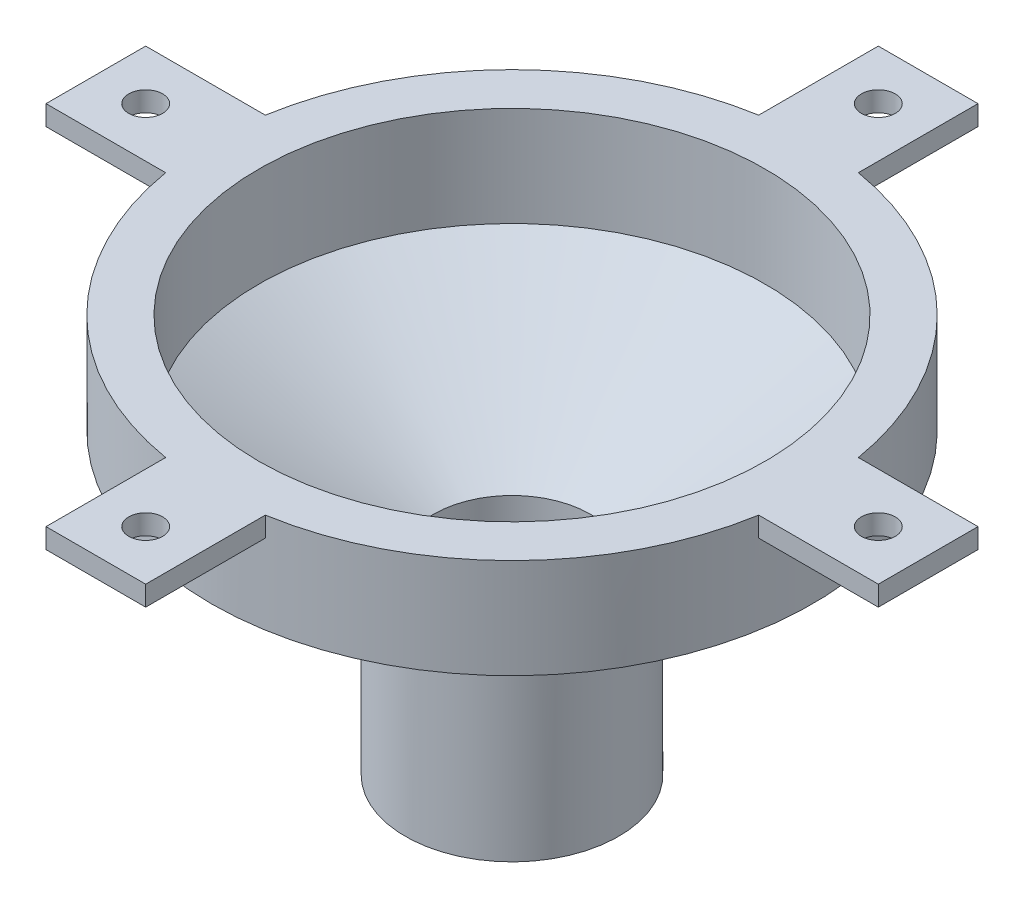
from build123d import *
from build123d.topology import SkipClean

# Parameters (mm, degrees)
SKETCH5_OUTSIDE_W   = 34.468
SKETCH5_OUTSIDE_H   = 34.468
CUT_EXTRUDE1_DEPTH  = 7.2
BOSS_EXTRUDE1_REACH = 51.718
SKETCH10_R          = 10.705
SKETCH10_R_2        = 6.9
SKETCH22_R          = 10.705
SKETCH22_R_2        = 7.874
BOSS_EXTRUDE7_DEPTH = 3
BOSS_EXTRUDE3_REACH = 31.655
SKETCH12_R          = 8.3
CUT_EXTRUDE3_REACH  = 56.551
SKETCH13_R          = 3.45
SKETCH14_R          = 23.979548074
CUT_EXTRUDE5_DEPTH  = 32
SKETCH17_R          = 30.1625
SKETCH17_R_2        = 25.4
BOSS_EXTRUDE5_DEPTH = 10
BOSS_EXTRUDE6_START = -2
SKETCH18_R          = 1.7
BOSS_EXTRUDE6_DEPTH = 2


# Read off the part's stored shape, not the designer's step: Cut-Extrude2
with BuildPart() as part:
    # Sketch1 → Revolve1 (revolve)
    with BuildSketch(Plane.XY, mode=Mode.PRIVATE) as revolve1_sk:
        Polygon((3.25, 47.7), (4.8, 47.7), (5.2, 43.217813034), (4.8, 42.533333333), (5.2, 38.051146367), (4.8, 37.366666667), (5.2, 32.8844797), (4.8, 32.2), (5.25, 26.2), (5.25, 22.2), (10.6, 22.2), (10.6, 15), (8.3, 15), (8.3, 0), (5.5, 0), (5.5, 18), (3.25, 19.7), align=None)
    revolve(revolve1_sk.sketch.rotate(Axis((0, 0, 0), (0, 1, 0)), 90), axis=Axis((0, 0, 0), (0, 1, 0)))

    # Sketch5 outside → Cut-Extrude1 (cut)
    with BuildSketch(Plane(origin=(0, 22.2, 0), x_dir=(1, 0, 0), z_dir=(0, 1, 0))):
        Rectangle(SKETCH5_OUTSIDE_W, SKETCH5_OUTSIDE_H)
        Polygon((-5.3, 9.17986928), (5.3, 9.17986928), (10.6, 0), (5.3, -9.17986928), (-5.3, -9.17986928), (-10.6, 0), align=None, mode=Mode.SUBTRACT)
    extrude(amount=-CUT_EXTRUDE1_DEPTH, mode=Mode.SUBTRACT)

    # Sketch4 → Cut-Revolve1 (revolve, cut)
    with BuildSketch(Plane.XY, mode=Mode.PRIVATE) as cut_revolve1_sk:
        Polygon((6.9, 0), (8.3, 1.4), (8.3, 0), align=None)
        Polygon((8.3, 15), (10.6, 15.837131539), (10.6, 15), align=None)
        Polygon((8.3, 22.2), (10.6, 21.362868461), (10.6, 22.2), align=None)
    revolve(cut_revolve1_sk.sketch.rotate(Axis((0, 0, 0), (0, 1, 0)), 90), axis=Axis((0, 0, 0), (0, 1, 0)), mode=Mode.SUBTRACT)

    # Boss-Extrude1: up to this cone (the profile starts outside it)
    boss_extrude1_end = Plane(origin=(0, 0, 0), z_dir=(0, 1, 0)).offset(11.979048056) * Cone(2.747e-06, 110.555614597, 40.238951944, align=(Align.CENTER, Align.CENTER, Align.MIN), mode=Mode.PRIVATE)
    # Sketch10 → Boss-Extrude1 (add, up to the surface)
    with BuildSketch(Plane.XZ, mode=Mode.PRIVATE) as boss_extrude1_sk1:
        with Locations(Location((0, 0, 0), (0, 0, 270))):
            Circle(SKETCH10_R)
        Circle(SKETCH10_R_2, mode=Mode.SUBTRACT)
    boss_extrude1_tool1 = extrude(boss_extrude1_sk1.sketch, amount=-BOSS_EXTRUDE1_REACH, mode=Mode.PRIVATE) - boss_extrude1_end
    add(boss_extrude1_tool1.solids().sort_by_distance((0, 0, 10.402217))[0])

    # Cut-Extrude2 outline → Cut-Extrude2 (revolve, cut)
    with BuildSketch(Plane.XY):
        Polygon((7.874, 16.206311111), (5.5, 18), (5.5, 0), (7.874, 0), align=None)
    revolve(axis=Axis((0, 0, 0), (0, 1, 0)), mode=Mode.SUBTRACT)

    # Sketch22 → Boss-Extrude7 (add)
    with SkipClean():  # the faces are left unmerged after this step: merging them gives an invalid solid
        with BuildSketch(Plane.XZ):
            with Locations(Location((0, 0, 0), (0, 0, 270))):
                Circle(SKETCH22_R)
            with Locations(Location((0, 0, 0), (0, 0, 270))):
                Circle(SKETCH22_R_2, mode=Mode.SUBTRACT)
        extrude(amount=BOSS_EXTRUDE7_DEPTH)

    # Boss-Extrude3: up to this cone (the profile starts inside it)
    with SkipClean():  # the faces are left unmerged after this step: merging them gives an invalid solid
        boss_extrude3_end = Plane(origin=(0, 22.2, 0), z_dir=(0, 1, 0)).offset(-10.220951944) * Cone(2.747e-06, 193.581188051, 70.457789364, align=(Align.CENTER, Align.CENTER, Align.MIN), mode=Mode.PRIVATE)
        # Sketch12 → Boss-Extrude3 (add, up to the surface)
        with BuildSketch(Plane(origin=(0, 22.2, 0), x_dir=(1, 0, 0), z_dir=(0, 1, 0)), mode=Mode.PRIVATE) as boss_extrude3_sk1:
            Polygon((-7.609401077, 13.17986928), (-15.218802154, 0), (-7.609401077, -13.17986928), (7.609401077, -13.17986928), (15.218802154, 0), (7.609401077, 13.17986928), align=None)
            Circle(SKETCH12_R, mode=Mode.SUBTRACT)
        boss_extrude3_tool1 = extrude(boss_extrude3_sk1.sketch, amount=-BOSS_EXTRUDE3_REACH, mode=Mode.PRIVATE) & boss_extrude3_end
        add(boss_extrude3_tool1.solids().sort_by_distance((-11.065395, 22.2, -6.388609))[0])

    # Cut-Extrude3: up to this cone (the profile starts outside it)
    with SkipClean():  # the faces are left unmerged after this step: merging them gives an invalid solid
        cut_extrude3_end = Plane(origin=(0, 47.7, 0), z_dir=(0, -1, 0)).offset(25.544445444) * Cone(1.324e-06, 41.699852941, 31.506554556, align=(Align.CENTER, Align.CENTER, Align.MIN), mode=Mode.PRIVATE)
        # Sketch13 → Cut-Extrude3 (cut, up to the surface)
        with BuildSketch(Plane(origin=(0, 47.7, 0), x_dir=(1, 0, 0), z_dir=(0, 1, 0)), mode=Mode.PRIVATE) as cut_extrude3_sk1:
            with Locations(Location((0, 0, 0), (0, 0, 270))):
                Circle(SKETCH13_R)
        cut_extrude3_tool1 = extrude(cut_extrude3_sk1.sketch, amount=-CUT_EXTRUDE3_REACH, mode=Mode.PRIVATE) - cut_extrude3_end
        add(cut_extrude3_tool1.solids().sort_by_distance((0, 47.7, 0))[0], mode=Mode.SUBTRACT)

    # Sketch14 → Cut-Extrude5 (cut)
    with SkipClean():  # the faces are left unmerged after this step: merging them gives an invalid solid
        with BuildSketch(Plane(origin=(0, 47.7, 0), x_dir=(1, 0, 0), z_dir=(0, 1, 0))):
            Circle(SKETCH14_R)
        extrude(amount=-CUT_EXTRUDE5_DEPTH, mode=Mode.SUBTRACT)

    # Sketch20 → Revolve2 (revolve)
    with SkipClean():  # the faces are left unmerged after this step: merging them gives an invalid solid
        with BuildSketch(Plane(origin=(0, 0, 0), x_dir=(0, 0, -1), z_dir=(1, 0, 0))):
            Polygon((10.705, 15.7), (30.1625, 26.933792863), (27.3315, 26.933792863), (7.874, 15.7), align=None)
        revolve(axis=Axis((0, 30.70199832, 0), (0, -1, 0)))

    # Sketch17 → Boss-Extrude5 (add)
    with SkipClean():  # the faces are left unmerged after this step: merging them gives an invalid solid
        with BuildSketch(Plane(origin=(0, 26.933792863, 0), x_dir=(1, 0, 0), z_dir=(0, 1, 0))):
            with Locations(Location((0, 0, 0), (0, 0, 270))):
                Circle(SKETCH17_R)
            with Locations(Location((0, 0, 0), (0, 0, 270))):
                Circle(SKETCH17_R_2, mode=Mode.SUBTRACT)
        extrude(amount=BOSS_EXTRUDE5_DEPTH)

    # Sketch18 → Boss-Extrude6 (add)
    # profile 1 of 8: a face of its own
    with SkipClean():  # the faces are left unmerged after this step: merging them gives an invalid solid
        with BuildSketch(Plane(origin=(0, 36.933792863, 0), x_dir=(1, 0, 0), z_dir=(0, 1, 0)).offset(BOSS_EXTRUDE6_START)):
            with BuildLine():
                ThreePointArc((-29.745191313, -5), (-30.1625, 0), (-29.745191313, 5))
                Line((-29.745191313, 5), (-41.745191313, 5))
                Line((-41.745191313, 5), (-41.745191313, -5))
                Line((-41.745191313, -5), (-29.745191313, -5))
            make_face()
            with Locations(Location((-36.745191313, 0, 0), (0, 0, 270))):
                Circle(SKETCH18_R, mode=Mode.SUBTRACT)
        # profile 2 of 8: a face of its own
        with BuildSketch(Plane(origin=(0, 36.933792863, 0), x_dir=(1, 0, 0), z_dir=(0, 1, 0)).offset(BOSS_EXTRUDE6_START)):
            with BuildLine():
                Line((-29.745191313, -5), (-29.745191313, 5))
                ThreePointArc((-29.745191313, 5), (-30.1625, 0), (-29.745191313, -5))
            make_face()
        # profile 3 of 8: a face of its own
        with BuildSketch(Plane(origin=(0, 36.933792863, 0), x_dir=(1, 0, 0), z_dir=(0, 1, 0)).offset(BOSS_EXTRUDE6_START)):
            with BuildLine():
                ThreePointArc((29.745191313, -5), (30.1625, 0), (29.745191313, 5))
                Line((29.745191313, 5), (29.745191313, -5))
            make_face()
        # profile 4 of 8: a face of its own
        with BuildSketch(Plane(origin=(0, 36.933792863, 0), x_dir=(1, 0, 0), z_dir=(0, 1, 0)).offset(BOSS_EXTRUDE6_START)):
            with BuildLine():
                Line((41.745191313, 5), (29.745191313, 5))
                ThreePointArc((29.745191313, 5), (30.1625, 0), (29.745191313, -5))
                Line((29.745191313, -5), (41.745191313, -5))
                Line((41.745191313, -5), (41.745191313, 5))
            make_face()
            with Locations(Location((36.745191313, 0, 0), (0, 0, 270))):
                Circle(SKETCH18_R, mode=Mode.SUBTRACT)
        # profile 5 of 8: a face of its own
        with BuildSketch(Plane(origin=(0, 36.933792863, 0), x_dir=(1, 0, 0), z_dir=(0, 1, 0)).offset(BOSS_EXTRUDE6_START)):
            with BuildLine():
                ThreePointArc((5, -29.745191313), (0, -30.1625), (-5, -29.745191313))
                Line((-5, -29.745191313), (-5, -41.745191313))
                Line((-5, -41.745191313), (5, -41.745191313))
                Line((5, -41.745191313), (5, -29.745191313))
            make_face()
            with Locations(Location((0, -36.745191313, 0), (0, 0, 270))):
                Circle(SKETCH18_R, mode=Mode.SUBTRACT)
        # profile 6 of 8: a face of its own
        with BuildSketch(Plane(origin=(0, 36.933792863, 0), x_dir=(1, 0, 0), z_dir=(0, 1, 0)).offset(BOSS_EXTRUDE6_START)):
            with BuildLine():
                Line((5, -29.745191313), (-5, -29.745191313))
                ThreePointArc((-5, -29.745191313), (0, -30.1625), (5, -29.745191313))
            make_face()
        # profile 7 of 8: a face of its own
        with BuildSketch(Plane(origin=(0, 36.933792863, 0), x_dir=(1, 0, 0), z_dir=(0, 1, 0)).offset(BOSS_EXTRUDE6_START)):
            with BuildLine():
                ThreePointArc((5, 29.745191313), (0, 30.1625), (-5, 29.745191313))
                Line((-5, 29.745191313), (5, 29.745191313))
            make_face()
        # profile 8 of 8: a face of its own
        with BuildSketch(Plane(origin=(0, 36.933792863, 0), x_dir=(1, 0, 0), z_dir=(0, 1, 0)).offset(BOSS_EXTRUDE6_START)):
            with BuildLine():
                Line((-5, 41.745191313), (-5, 29.745191313))
                ThreePointArc((-5, 29.745191313), (0, 30.1625), (5, 29.745191313))
                Line((5, 29.745191313), (5, 41.745191313))
                Line((5, 41.745191313), (-5, 41.745191313))
            make_face()
            with Locations(Location((0, 36.745191313, 0), (0, 0, 270))):
                Circle(SKETCH18_R, mode=Mode.SUBTRACT)
        extrude(amount=BOSS_EXTRUDE6_DEPTH)


solid = part.part
